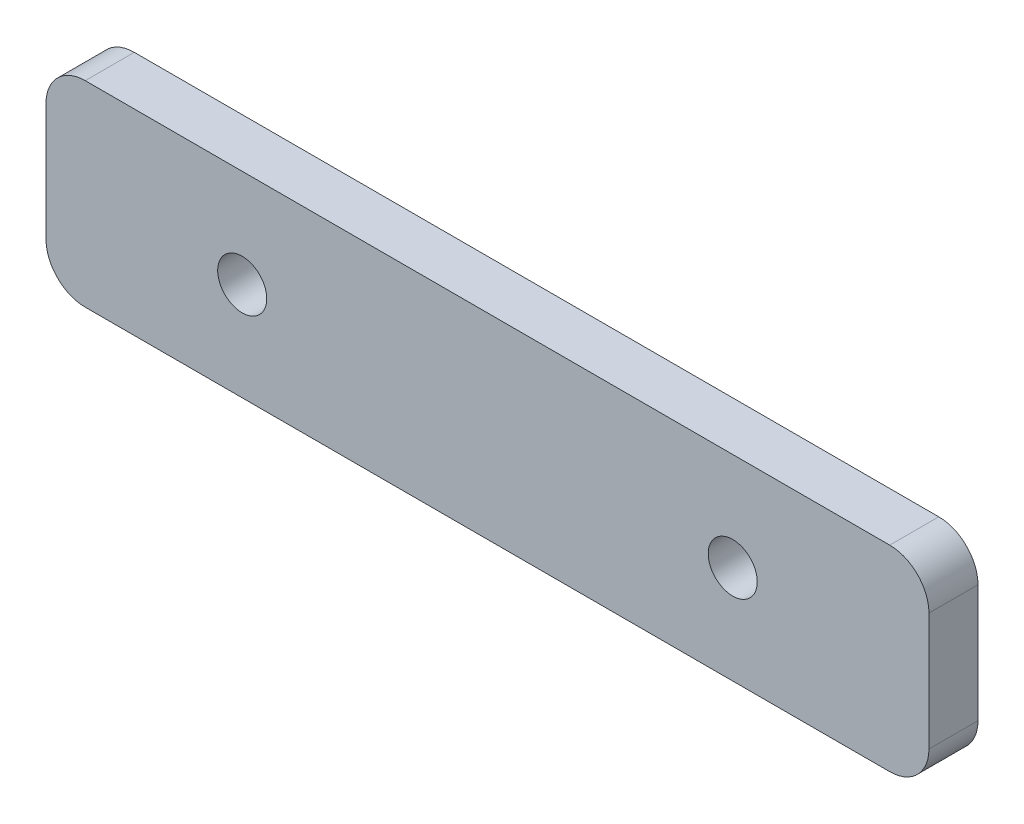
from build123d import *

# Parameters (mm, degrees)
SKETCH1_W           = 57.15
SKETCH1_H           = 12.7
SKETCH1_R           = 1.5875
BOSS_EXTRUDE1_DEPTH = 3.175
FILLET1_R           = 2.54


with BuildPart() as part:
    # Sketch1 → Boss-Extrude1 (new body)
    with BuildSketch(Plane.XY):
        Rectangle(SKETCH1_W, SKETCH1_H)
        with Locations((-15.875, 0)):
            Circle(SKETCH1_R, mode=Mode.SUBTRACT)
        with Locations((15.875, 0)):
            Circle(SKETCH1_R, mode=Mode.SUBTRACT)
    extrude(amount=BOSS_EXTRUDE1_DEPTH)

    # Fillet1
    fillet1_edges = [part.edges().sort_by_distance(p)[0] for p in [
        (28.575, -6.35, 1.5875),
        (-28.575, -6.35, 1.5875),
        (28.575, 6.35, 1.5875),
        (-28.575, 6.35, 1.5875),
    ]]
    fillet(fillet1_edges, radius=FILLET1_R)


solid = part.part
